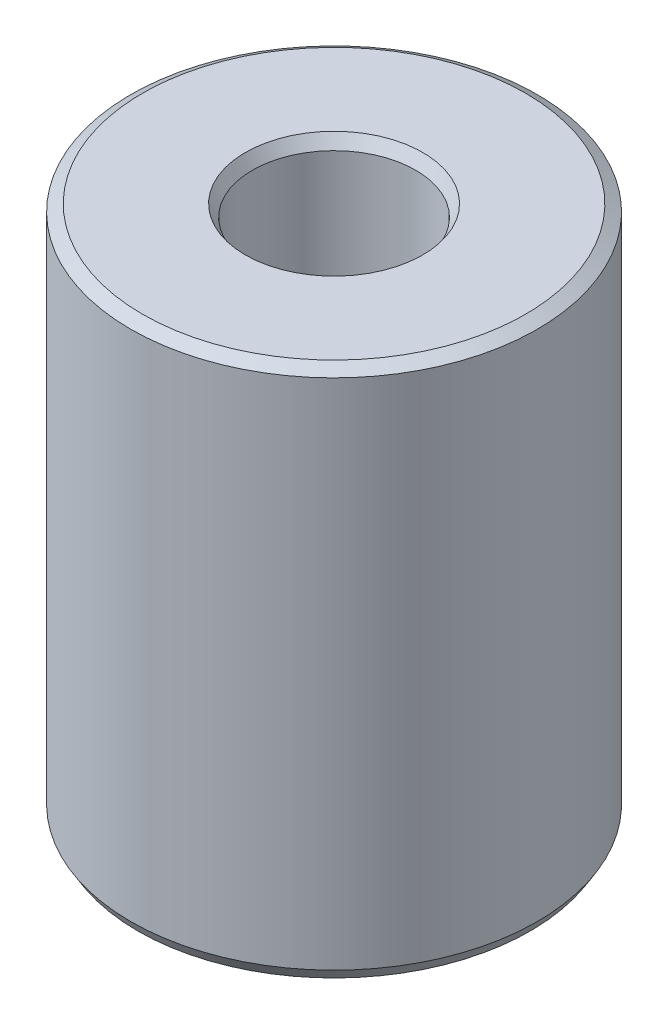
from build123d import *
from OCP.BRepFilletAPI import BRepFilletAPI_MakeChamfer

# Parameters (mm, degrees)
SKETCH1_R           = 22.5
BOSS_EXTRUDE1_DEPTH = 58.866677343
SKETCH2_R           = 9.03902492
CUT_EXTRUDE1_DEPTH  = 67.916258872
CHAMFER1_SIZE       = 0.785223286
CHAMFER1_SIZE2      = 1.303933937


with BuildPart() as part:
    # Sketch1 → Boss-Extrude1 (new body)
    with BuildSketch(Plane(origin=(0, 0, 0), x_dir=(1, 0, 0), z_dir=(0, 1, 0))):
        Circle(SKETCH1_R)
    extrude(amount=BOSS_EXTRUDE1_DEPTH)

    # Sketch2 → Cut-Extrude1 (cut, through all)
    with BuildSketch(Plane(origin=(0, 0, 0), x_dir=(1, 0, 0), z_dir=(0, 1, 0))):
        Circle(SKETCH2_R)
    extrude(amount=CUT_EXTRUDE1_DEPTH, mode=Mode.SUBTRACT)

    # Chamfer1: one chamfer whose edges measure the first distance from different faces: ONE call of the kernel's chamfer builder (chamfer() names one face for all edges)
    chamfer1_edges_1 = [part.edges().sort_by_distance(p)[0] for p in [
        (-9.03902492, 58.866677343, 0),
    ]]
    chamfer1_side_1 = [part.faces().sort_by_distance(p)[0] for p in [
        (-21.863603897, 58.866677343, 0),
    ]]
    chamfer1_edges_2 = [part.edges().sort_by_distance(p)[0] for p in [
        (-9.03902492, 0, 0),
    ]]
    chamfer1_side_2 = [part.faces().sort_by_distance(p)[0] for p in [
        (-9.03902492, 29.433338672, 0),
    ]]
    chamfer1_edges_3 = [part.edges().sort_by_distance(p)[0] for p in [
        (-22.5, 0, 0),
    ]]
    chamfer1_side_3 = [part.faces().sort_by_distance(p)[0] for p in [
        (-21.863603897, 0, 0),
    ]]
    chamfer1_edges_4 = [part.edges().sort_by_distance(p)[0] for p in [
        (-22.5, 58.866677343, 0),
    ]]
    chamfer1_side_4 = [part.faces().sort_by_distance(p)[0] for p in [
        (-22.5, 29.433338672, 0),
    ]]
    chamfer1 = BRepFilletAPI_MakeChamfer(part.part.solid().wrapped)
    for e in chamfer1_edges_1:
        chamfer1.Add(CHAMFER1_SIZE, CHAMFER1_SIZE2, e.wrapped, chamfer1_side_1[0].wrapped)  # the first distance lies on this face
    for e in chamfer1_edges_2:
        chamfer1.Add(CHAMFER1_SIZE, CHAMFER1_SIZE2, e.wrapped, chamfer1_side_2[0].wrapped)  # the first distance lies on this face
    for e in chamfer1_edges_3:
        chamfer1.Add(CHAMFER1_SIZE, CHAMFER1_SIZE2, e.wrapped, chamfer1_side_3[0].wrapped)  # the first distance lies on this face
    for e in chamfer1_edges_4:
        chamfer1.Add(CHAMFER1_SIZE, CHAMFER1_SIZE2, e.wrapped, chamfer1_side_4[0].wrapped)  # the first distance lies on this face
    add(Compound.cast(chamfer1.Shape()), mode=Mode.REPLACE)


solid = part.part
